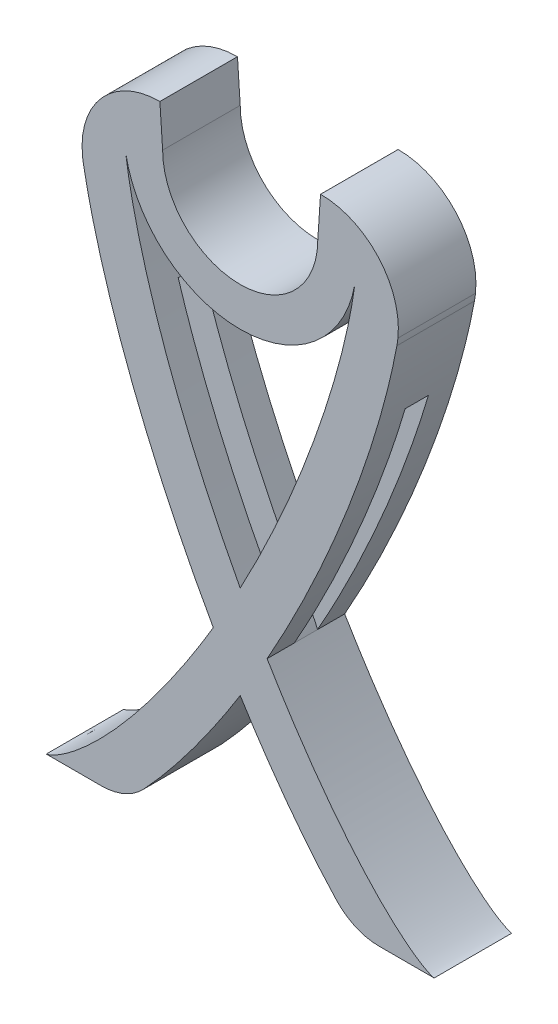
from build123d import *
from OCP.BRepAlgoAPI import BRepAlgoAPI_Cut
from OCP.TopTools import TopTools_ListOfShape

# Parameters (mm, degrees)
EXTRUDE_1_DEPTH          = 20
EXTRUDE_2_DEPTH          = 20
CUT_EXTRUDE_1_DEPTH      = 20
FILLET_START             = -1
FILLET_1_DEPTH           = 22
FILLET_5_R               = 20
CUT_EXTRUDE_2_DEPTH      = 170.133958747
CUT_EXTRUDE_2_DEPTH_BACK = 170.133958747
SKETCH_7_W               = 6
SKETCH_7_H               = 56.597587307
FILLET_8_R               = 15
FILLET_START_2           = 7
FILLET_9_DEPTH           = 6


with BuildPart() as part:
    # 草图2 → 凸台-拉伸1 (new body)
    with BuildSketch(Plane.XY):
        with BuildLine():
            Line((-41.999215201, 149.862760974), (-30, 150))
            add(Edge.make_bspline(
                [(50, 0), (49.978936658, 0.001800015), (49.936997227, 0.006786133), (49.853876264, 0.022329249), (49.6882259, 0.06205009), (49.380624713, 0.155151864), (48.842812142, 0.359607586), (47.977600653, 0.762748924), (46.69077089, 1.481073252), (44.895237574, 2.654694887), (42.408238171, 4.527841243), (39.408651857, 7.109203359), (35.439286018, 10.932302616), (30.552001155, 16.217358827), (25.137506821, 22.750309162), (19.300678452, 30.55883989), (13.597434615, 38.917016787), (8.211031911, 47.482206169), (3.117685264, 56.224435649), (-1.696232447, 65.123424776), (-6.236635362, 74.164911025), (-10.502850506, 83.338988567), (-14.487406006, 92.638909479), (-18.175570208, 102.060540951), (-21.542310087, 111.602022272), (-24.549009692, 121.263720616), (-26.925259526, 130.268192952), (-28.584821395, 138.077123235), (-29.476363221, 143.765954794), (-29.857342569, 147.278544852), (-29.972913338, 149.084710759), (-29.996509056, 149.694776451), (-30, 150)],
                knots=[0, 0, 0, 0, 0, 0.00048493, 0.000969859, 0.001939718, 0.003909294, 0.007857842, 0.014167135, 0.023832963, 0.037713143, 0.057064454, 0.085593018, 0.114621613, 0.164170458, 0.222228094, 0.280285705, 0.338343295, 0.396400929, 0.454458532, 0.512516146, 0.570573787, 0.628631391, 0.68668903, 0.744746653, 0.802804277, 0.860861895, 0.918919512, 0.958458799, 0.985986087, 0.992993044, 1, 1, 1, 1, 1], degree=4))
            Line((50, 0), (29.524286112, 0))
            add(Edge.make_bspline(
                [(29.524286112, 0), (29.176239312, 0.334196655), (28.100724989, 1.381543838), (26.350318822, 3.156127146), (23.618362999, 6.060557113), (20.366386751, 9.744788144), (16.662909292, 14.242115238), (13.124050434, 18.807990355), (8.593618413, 24.978561939), (3.241347861, 32.833411034), (-2.767161585, 42.456714052), (-8.406183129, 52.258556926), (-13.701667255, 62.227343946), (-18.665729508, 72.356703891), (-23.29984122, 82.645537761), (-27.595078644, 93.097375209), (-31.530689858, 103.723477957), (-34.480334517, 112.740017572), (-36.610001719, 120.072898929), (-38.07870842, 125.640819912), (-39.182289864, 130.351832732), (-39.978820084, 134.177819701), (-40.528077418, 137.080179015), (-41.023291813, 140.031622065), (-41.381813492, 142.537113845), (-41.629518942, 144.600758824), (-41.764447781, 145.927855649), (-41.856863172, 147.013944599), (-41.918056372, 147.855889228), (-41.960959054, 148.601207544), (-41.987900102, 149.270854718), (-41.99702035, 149.670858596), (-41.999215201, 149.862760974)],
                knots=[0.086398654, 0.086398654, 0.086398654, 0.086398654, 0.09375, 0.109375, 0.125, 0.15625, 0.1875, 0.21875, 0.25, 0.3125, 0.375, 0.4375, 0.5, 0.5625, 0.625, 0.6875, 0.75, 0.8125, 0.84375, 0.875, 0.90625, 0.921875, 0.9375, 0.953125, 0.96875, 0.9765625, 0.984375, 0.98828125, 0.9921875, 0.99609375, 0.998046875, 1, 1, 1, 1], degree=3))
        make_face()
        with BuildLine():
            Line((-50, 0), (-29.524286112, 0))
            add(Edge.make_bspline(
                [(-29.524286112, 0), (-29.339344111, 0.177593526), (-28.971657528, 0.533300439), (-27.902491695, 1.582405348), (-26.330109668, 3.177612147), (-23.618362999, 6.060557113), (-20.366386751, 9.744788144), (-16.662909292, 14.242115238), (-13.124050434, 18.807990355), (-8.593618413, 24.978561939), (-3.241347861, 32.833411034), (2.767161585, 42.456714052), (8.406183129, 52.258556926), (13.701667255, 62.227343946), (18.665729508, 72.356703891), (23.29984122, 82.645537761), (27.595078644, 93.097375209), (31.530689858, 103.723477957), (34.480334517, 112.740017572), (36.610001719, 120.072898929), (38.07870842, 125.640819912), (39.182289864, 130.351832732), (39.978820084, 134.177819701), (40.528077418, 137.080179015), (41.023291813, 140.031622065), (41.381813492, 142.537113845), (41.629518942, 144.600758824), (41.764447781, 145.927855649), (41.856863172, 147.013944599), (41.918056372, 147.855889228), (41.960959054, 148.601207544), (41.987900102, 149.270854718), (41.99702035, 149.670858596), (41.999215201, 149.862760974)],
                knots=[0.086399833, 0.086399833, 0.086399833, 0.086399833, 0.090306083, 0.094212333, 0.109375, 0.125, 0.15625, 0.1875, 0.21875, 0.25, 0.3125, 0.375, 0.4375, 0.5, 0.5625, 0.625, 0.6875, 0.75, 0.8125, 0.84375, 0.875, 0.90625, 0.921875, 0.9375, 0.953125, 0.96875, 0.9765625, 0.984375, 0.98828125, 0.9921875, 0.99609375, 0.998046875, 1, 1, 1, 1], degree=3))
            Line((41.999215201, 149.862760974), (30, 150))
            add(Edge.make_bspline(
                [(-50, 0), (-49.978936658, 0.001800015), (-49.936997227, 0.006786133), (-49.853876264, 0.022329249), (-49.6882259, 0.06205009), (-49.380624713, 0.155151864), (-48.842812142, 0.359607586), (-47.977600653, 0.762748924), (-46.69077089, 1.481073252), (-44.895237574, 2.654694887), (-42.408238171, 4.527841243), (-39.408651857, 7.109203359), (-35.439286018, 10.932302616), (-30.552001155, 16.217358827), (-25.137506821, 22.750309162), (-19.300678452, 30.55883989), (-13.597434615, 38.917016787), (-8.211031911, 47.482206169), (-3.117685264, 56.224435649), (1.696232447, 65.123424776), (6.236635362, 74.164911025), (10.502850506, 83.338988567), (14.487406006, 92.638909479), (18.175570208, 102.060540951), (21.542310087, 111.602022272), (24.549009692, 121.263720616), (26.925259526, 130.268192952), (28.584821395, 138.077123235), (29.476363221, 143.765954794), (29.857342569, 147.278544852), (29.972913338, 149.084710759), (29.996509056, 149.694776451), (30, 150)],
                knots=[0, 0, 0, 0, 0, 0.00048493, 0.000969859, 0.001939718, 0.003909294, 0.007857842, 0.014167135, 0.023832963, 0.037713143, 0.057064454, 0.085593018, 0.114621613, 0.164170458, 0.222228094, 0.280285705, 0.338343295, 0.396400929, 0.454458532, 0.512516146, 0.570573787, 0.628631391, 0.68668903, 0.744746653, 0.802804277, 0.860861895, 0.918919512, 0.958458799, 0.985986087, 0.992993044, 1, 1, 1, 1, 1], degree=4))
        make_face()
    extrude(amount=EXTRUDE_1_DEPTH)

    # 草图3 → 凸台-拉伸2 (add)
    with BuildSketch(Plane.XY):
        with BuildLine():
            Line((41.999215201, 149.862760974), (21.410487348, 170.839152121))
            Line((21.410487348, 170.839152121), (20, 149.82435057))
            ThreePointArc((20, 149.82435057), (0, 129.82435057), (-20, 149.82435057))
            Line((-20, 149.82435057), (-21.410487348, 170.839152121))
            Line((-21.410487348, 170.839152121), (-41.999215201, 149.862760974))
            Line((-41.999215201, 149.862760974), (-30.000489619, 149.862760974))
            ThreePointArc((-30.000489619, 149.862760974), (-0.019205206, 119.82384251), (30.000514208, 149.82435057))
            Line((30.000514208, 149.82435057), (41.999215201, 149.862760974))
        make_face()
    extrude(amount=EXTRUDE_2_DEPTH)

    # 草图6 → 切除-拉伸1 (cut)
    with BuildSketch(Plane.XY):
        Polygon((-31.704851275, 160.350956548), (-20.705243674, 160.331751346), (-21.410487348, 170.839152121), align=None)
        Polygon((20.705243674, 160.331751346), (31.704851275, 160.350956548), (21.410487348, 170.839152121), align=None)
    extrude(amount=CUT_EXTRUDE_1_DEPTH, mode=Mode.SUBTRACT)

    # 圆角1: read off the stored shape, not the designer's step
    # 圆角1 outline → 圆角1 (cut)
    with BuildSketch(Plane.XY.offset(FILLET_START)):
        with BuildLine():
            Line((41.999215201, 149.862760974), (33.638841939, 158.380550949))
            ThreePointArc((33.638841939, 158.380550949), (39.701364667, 148.188689544), (40.385299029, 136.349751479))
            add(Edge.make_bspline(
                [(40.385299029, 136.349751479), (40.430454795, 136.595460223), (40.651406794, 137.815213447), (41.023291813, 140.031622065), (41.381813492, 142.537113845), (41.629518942, 144.600758824), (41.764447781, 145.927855649), (41.856863172, 147.013944599), (41.918056372, 147.855889228), (41.960959054, 148.601207544), (41.987900102, 149.270854718), (41.99702035, 149.670858596), (41.999215201, 149.862760974)],
                knots=[0.933548862, 0.933548862, 0.933548862, 0.933548862, 0.9375, 0.953125, 0.96875, 0.9765625, 0.984375, 0.98828125, 0.9921875, 0.99609375, 0.998046875, 1, 1, 1, 1], degree=3))
        make_face()
        with BuildLine():
            add(Edge.make_bspline(
                [(-40.38529763, 136.349750141), (-40.430453532, 136.5954595), (-40.651405746, 137.815213291), (-41.02329104, 140.031622447), (-41.381812913, 142.537114121), (-41.629518524, 144.600759016), (-41.764447467, 145.92785579), (-41.856862944, 147.013944698), (-41.91805621, 147.855889296), (-41.960958952, 148.601207586), (-41.987900054, 149.270854737), (-41.997020334, 149.670858602), (-41.999215201, 149.862760974)],
                knots=[0.933548852, 0.933548852, 0.933548852, 0.933548852, 0.9375, 0.953125, 0.96875, 0.9765625, 0.984375, 0.98828125, 0.9921875, 0.99609375, 0.998046875, 1, 1, 1, 1], degree=3))
            ThreePointArc((-40.38529763, 136.349750141), (-39.701364042, 148.188689403), (-33.638840967, 158.380551939))
            Line((-33.638840967, 158.380551939), (-41.999215201, 149.862760974))
        make_face()
    extrude(amount=FILLET_1_DEPTH, mode=Mode.SUBTRACT)

    # 圆角5
    fillet_5_edges = [part.edges().sort_by_distance(p)[0] for p in [
        (31.704851275, 160.350956548, 10),
        (-31.704851275, 160.350956548, 10),
    ]]
    fillet(fillet_5_edges, radius=FILLET_5_R)

    # 草图7 → 切除-拉伸2 (cut, two sides: drawn at the far end of the back side and taken through both)
    with BuildSketch(Plane(origin=(0, 0, 0), x_dir=(0, 0, -1), z_dir=(1, 0, 0)).offset(-CUT_EXTRUDE_2_DEPTH_BACK)):
        with Locations((-10, 88.050957826)):
            Rectangle(SKETCH_7_W, SKETCH_7_H)
    extrude(amount=CUT_EXTRUDE_2_DEPTH + CUT_EXTRUDE_2_DEPTH_BACK, mode=Mode.SUBTRACT)

    # 圆角8
    fillet_8_edges = [part.edges().sort_by_distance(p)[0] for p in [
        (29.524286112, 0, 10),
        (-29.524286112, 0, 10),
    ]]
    fillet(fillet_8_edges, radius=FILLET_8_R)


with BuildPart() as fillet_9_tool:
    # 圆角9: read off the stored shape, not the designer's step
    # 圆角9 outline → 圆角9 (new body)
    with BuildSketch(Plane.XY.offset(FILLET_START_2)):
        with BuildLine():
            ThreePointArc((-6.932849809, 49.75217319), (-4.218419953, 54.468522221), (1.084e-06, 57.906108814))
            ThreePointArc((1.084e-06, 57.906108814), (4.218425219, 54.468518578), (6.932855164, 49.752164172))
            add(Edge.make_bspline(
                [(6.932855164, 49.752164172), (7.40870741, 50.595044607), (9.259524234, 53.907500177), (11.052228388, 57.248195959), (12.356354725, 59.752164172)],
                knots=[0.421442346, 0.421442346, 0.421442346, 0.421442346, 0.4375, 0.484408046, 0.484408046, 0.484408046, 0.484408046], degree=3))
            Line((12.356354725, 59.752164172), (-12.356345577, 59.752164172))
            add(Edge.make_bspline(
                [(-6.932849809, 49.75217319), (-7.40870152, 50.59505254), (-9.259517012, 53.907505132), (-11.052219934, 57.248197894), (-12.356345577, 59.752164172)],
                knots=[0.421442366, 0.421442366, 0.421442366, 0.421442366, 0.4375, 0.484408013, 0.484408013, 0.484408013, 0.484408013], degree=3))
        make_face()
    extrude(amount=FILLET_9_DEPTH)


with BuildPart() as part_1:
    add(part.part)

    # 圆角9: cut by fillet_9_tool, with a tolerance
    fillet_9_stock = TopTools_ListOfShape()
    fillet_9_stock.Append(part_1.part.wrapped)
    fillet_9_tools = TopTools_ListOfShape()
    fillet_9_tools.Append(fillet_9_tool.part.wrapped)
    fillet_9_cut = BRepAlgoAPI_Cut()
    fillet_9_cut.SetArguments(fillet_9_stock)
    fillet_9_cut.SetTools(fillet_9_tools)
    fillet_9_cut.SetFuzzyValue(0.00001)
    fillet_9_cut.Build()
    add(Compound.cast(fillet_9_cut.Shape()).solids(), mode=Mode.REPLACE)


solid = part_1.part
